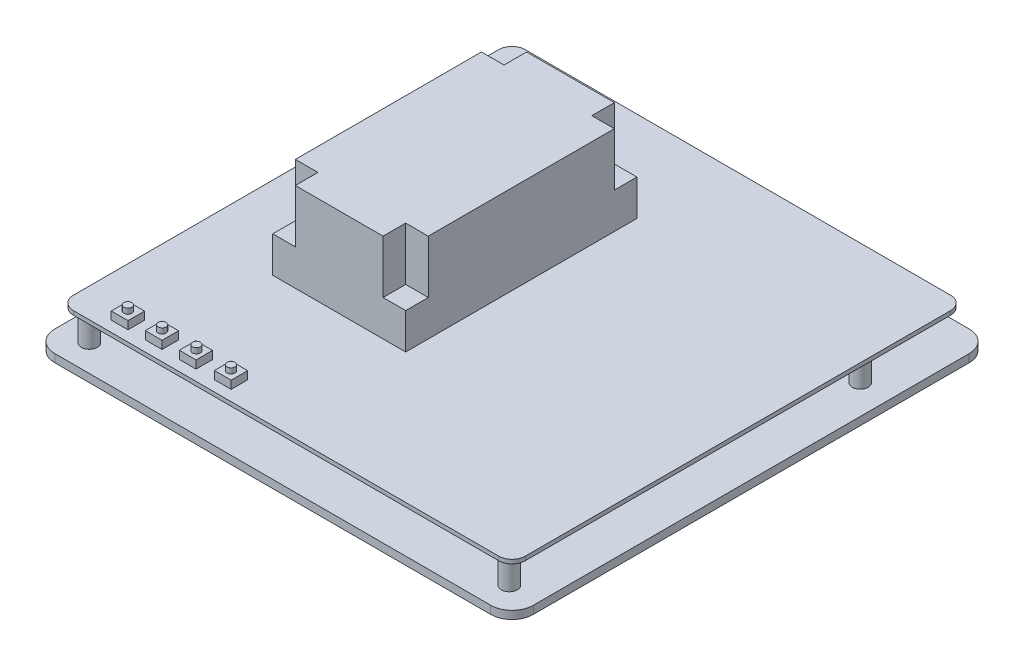
from build123d import *

# Parameters (mm, degrees)
RESSALTO_EXTRUS_O1_DEPTH = 3
ESBO_O2_R                = 3.5
RESSALTO_EXTRUS_O2_DEPTH = 5
ESBO_O3_R                = 3
RESSALTO_EXTRUS_O3_DEPTH = 11
RESSALTO_EXTRUS_O4_DEPTH = 1.5
ESBO_O5_W                = 50
ESBO_O5_H                = 87
RESSALTO_EXTRUS_O5_DEPTH = 33.5
ESBO_O6_W                = 8.5
ESBO_O6_H                = 8.5
CORTE_EXTRUS_O1_DEPTH    = 20
ESBO_O7_W                = 6.3
ESBO_O7_H                = 6.2
RESSALTO_EXTRUS_O6_DEPTH = 3
ESBO_O8_R                = 1.5
RESSALTO_EXTRUS_O7_DEPTH = 2


with BuildPart() as part:
    # Esboço1 → Ressalto-extrusão1 (new body)
    with BuildSketch(Plane(origin=(0, 0, 0), x_dir=(1, 0, 0), z_dir=(0, 1, 0))):
        with BuildLine():
            Line((82, -90), (-82, -90))
            ThreePointArc((-82, -90), (-87.656854249, -87.656854249), (-90, -82))
            Line((-90, -82), (-90, 82))
            ThreePointArc((-90, 82), (-87.656854249, 87.656854249), (-82, 90))
            Line((-82, 90), (82, 90))
            ThreePointArc((82, 90), (87.656854249, 87.656854249), (90, 82))
            Line((90, 82), (90, -82))
            ThreePointArc((90, -82), (87.656854249, -87.656854249), (82, -90))
        make_face()
    extrude(amount=RESSALTO_EXTRUS_O1_DEPTH)

    # Esboço2 → Ressalto-extrusão2 (add)
    with BuildSketch(Plane(origin=(0, 0, 0), x_dir=(-1, 0, 0), z_dir=(0, -1, 0))):
        with Locations((79, -62)):
            Circle(ESBO_O2_R)
        with Locations((-79, -62)):
            Circle(ESBO_O2_R)
        with Locations((-79, 62)):
            Circle(ESBO_O2_R)
        with Locations((79, 62)):
            Circle(ESBO_O2_R)
    extrude(amount=RESSALTO_EXTRUS_O2_DEPTH)

    # Esboço3 → Ressalto-extrusão3 (add)
    with BuildSketch(Plane(origin=(0, 3, 0), x_dir=(1, 0, 0), z_dir=(0, 1, 0))):
        with Locations((-79, -80)):
            Circle(ESBO_O3_R)
        with Locations((-79, 75)):
            Circle(ESBO_O3_R)
        with Locations((79, 52)):
            Circle(ESBO_O3_R)
        with Locations((79, -80)):
            Circle(ESBO_O3_R)
    extrude(amount=RESSALTO_EXTRUS_O3_DEPTH)

    # Esboço4 → Ressalto-extrusão4 (add)
    with BuildSketch(Plane(origin=(0, 14, 0), x_dir=(1, 0, 0), z_dir=(0, 1, 0))):
        with BuildLine():
            Line((-80, 85), (80, 85))
            ThreePointArc((80, 85), (83.535533906, 83.535533906), (85, 80))
            Line((85, 80), (85, -80))
            ThreePointArc((85, -80), (83.535533906, -83.535533906), (80, -85))
            Line((80, -85), (-80, -85))
            ThreePointArc((-80, -85), (-83.535533906, -83.535533906), (-85, -80))
            Line((-85, -80), (-85, 80))
            ThreePointArc((-85, 80), (-83.535533906, 83.535533906), (-80, 85))
        make_face()
    extrude(amount=RESSALTO_EXTRUS_O4_DEPTH)

    # Esboço5 → Ressalto-extrusão5 (add)
    with BuildSketch(Plane(origin=(0, 15.5, 0), x_dir=(1, 0, 0), z_dir=(0, 1, 0))):
        with Locations((-29, 7.5)):
            Rectangle(ESBO_O5_W, ESBO_O5_H)
    extrude(amount=RESSALTO_EXTRUS_O5_DEPTH)

    # Esboço6 → Corte-extrusão1 (cut)
    with BuildSketch(Plane(origin=(0, 49, 0), x_dir=(1, 0, 0), z_dir=(0, 1, 0))):
        with Locations((-49.75, -31.75)):
            Rectangle(ESBO_O6_W, ESBO_O6_H)
        with Locations((-8.25, -31.75)):
            Rectangle(ESBO_O6_W, ESBO_O6_H)
        with Locations((-8.25, 46.75)):
            Rectangle(ESBO_O6_W, ESBO_O6_H)
        with Locations((-49.75, 46.75)):
            Rectangle(ESBO_O6_W, ESBO_O6_H)
    extrude(amount=-CORTE_EXTRUS_O1_DEPTH, mode=Mode.SUBTRACT)

    # Esboço7 → Ressalto-extrusão6 (add)
    with BuildSketch(Plane(origin=(0, 15.5, 0), x_dir=(1, 0, 0), z_dir=(0, 1, 0))):
        with Locations((-27.8, -77.9)):
            Rectangle(ESBO_O7_W, ESBO_O7_H)
        with Locations((-66.6, -77.9)):
            Rectangle(ESBO_O7_W, ESBO_O7_H)
        with Locations((-53.8, -77.9)):
            Rectangle(ESBO_O7_W, ESBO_O7_H)
        with Locations((-41, -77.9)):
            Rectangle(ESBO_O7_W, ESBO_O7_H)
    extrude(amount=RESSALTO_EXTRUS_O6_DEPTH)

    # Esboço8 → Ressalto-extrusão7 (add)
    with BuildSketch(Plane(origin=(0, 18.5, 0), x_dir=(1, 0, 0), z_dir=(0, 1, 0))):
        with Locations((-66.6, -77.9)):
            Circle(ESBO_O8_R)
        with Locations((-53.7, -77.9)):
            Circle(ESBO_O8_R)
        with Locations((-40.8, -77.9)):
            Circle(ESBO_O8_R)
        with Locations((-27.75, -77.95)):
            Circle(ESBO_O8_R)
    extrude(amount=RESSALTO_EXTRUS_O7_DEPTH)


solid = part.part
